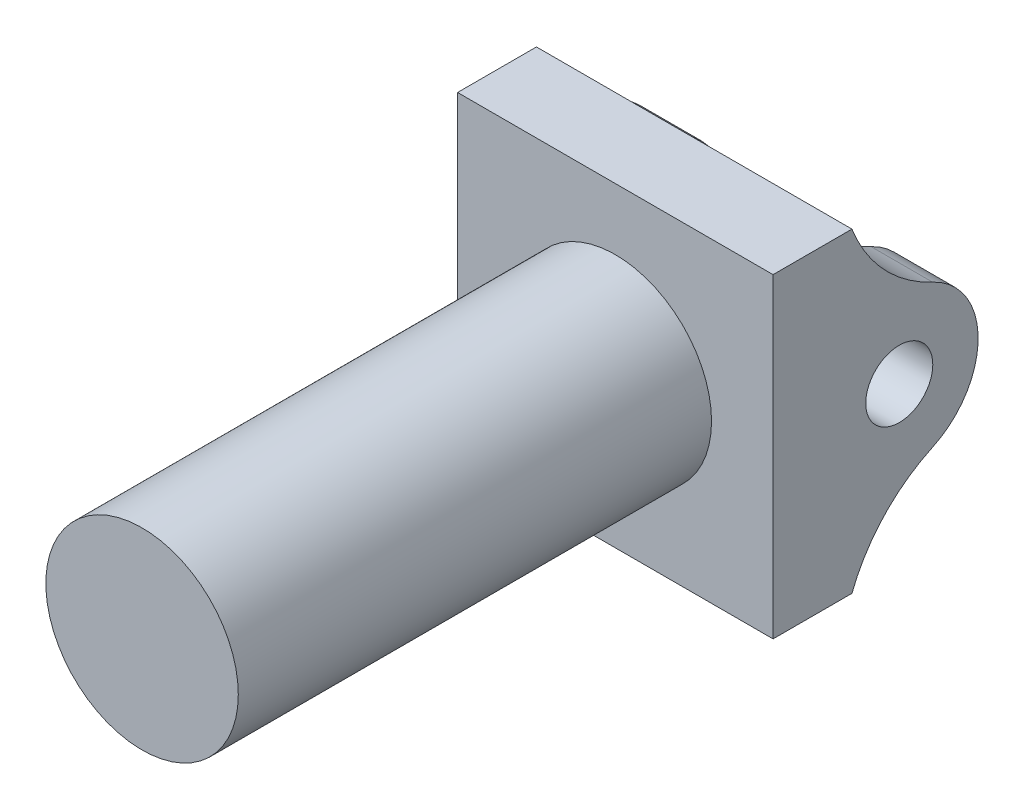
from build123d import *

# Parameters (mm, degrees)
SKETCH2_R               = 6.1
BOSS_EXTRUDE1_DEPTH     = 30
SKETCH3_W               = 20
SKETCH3_H               = 20
BOSS_EXTRUDE2_DEPTH     = 5
SKETCH4_R               = 2.125
BOSS_EXTRUDE3_DEPTH     = 20
CUT_EXTRUDE1_DEPTH      = 20
CUT_EXTRUDE1_DEPTH_BACK = 20
SKETCH5_W               = 12.2
SKETCH5_H               = 16
FILLET2_R               = 10


with BuildPart() as part:
    # Sketch2 → Boss-Extrude1 (new body)
    with BuildSketch(Plane.XY):
        Circle(SKETCH2_R)
    extrude(amount=BOSS_EXTRUDE1_DEPTH)

    # Sketch3 → Boss-Extrude2 (add)
    with BuildSketch(Plane(origin=(0, 0, 0), x_dir=(-1, 0, 0), z_dir=(0, 0, -1))):
        Rectangle(SKETCH3_W, SKETCH3_H)
    extrude(amount=BOSS_EXTRUDE2_DEPTH)

    # Sketch4 → Boss-Extrude3 (add)
    with BuildSketch(Plane(origin=(10, 0, 0), x_dir=(0, 0, -1), z_dir=(1, 0, 0))):
        with BuildLine():
            Line((5, 0), (5, 5))
            Line((5, 5), (8, 5))
            ThreePointArc((8, 5), (13, 0), (8, -5))
            Line((8, -5), (5, -5))
            Line((5, -5), (5, 0))
        make_face()
        with Locations((8, 0)):
            Circle(SKETCH4_R, mode=Mode.SUBTRACT)
    extrude(amount=-BOSS_EXTRUDE3_DEPTH)

    # Sketch5 → Cut-Extrude1 (cut, two sides: drawn at the far end of the back side and taken through both)
    with BuildSketch(Plane(origin=(0, 0, 0), x_dir=(1, 0, 0), z_dir=(0, 1, 0)).offset(-CUT_EXTRUDE1_DEPTH_BACK)):
        with Locations((0, 13)):
            Rectangle(SKETCH5_W, SKETCH5_H)
    extrude(amount=CUT_EXTRUDE1_DEPTH + CUT_EXTRUDE1_DEPTH_BACK, mode=Mode.SUBTRACT)

    # Fillet2
    # the kernel refuses this fillet: 10 mm, written as the material it adds along each edge
    with BuildSketch(Plane(origin=(6.728171707, 5, -5), x_dir=(0, -0.09101222312672333, -0.9958497754388116), z_dir=(-1, 0, 0))) as fillet2_piece_1_section:
        with BuildLine():
            CenterArc((8.508585165, -9.412424416), FILLET2_R, 109.738733942, 43.945519562)
            Line((-0.455061116, -4.979248877), (-1.351425744, -4.535931323))
            ThreePointArc((-1.351425744, -4.535931323), (-1.223380333, -2.398612215), (-0.995849775, 0.091012223))
            Line((-0.995849775, 0.091012223), (0.091012223, 0.995849775))
            ThreePointArc((0.091012223, 0.995849775), (3.078561549, 0.722813106), (4.793537035, 0.941242442))
            Line((4.793537035, 0.941242442), (5.131268683, 0))
        make_face()
    fillet2_piece_1 = extrude(amount=16.728171707, mode=Mode.PRIVATE)
    fillet2_piece_1 = split(fillet2_piece_1, bisect_by=Plane(origin=(6.1, 6.116270273, -6.110221206), z_dir=(1, 0, 0)), keep=Keep.TOP, mode=Mode.PRIVATE)
    add(fillet2_piece_1)
    with BuildSketch(Plane(origin=(-6.1, 5, -5), x_dir=(0, -0.09101222312672332, -0.9958497754388116), z_dir=(-1, 0, 0))) as fillet2_piece_2:
        with BuildLine():
            CenterArc((8.508585165, -9.412424416), FILLET2_R, 109.738733942, 43.945519562)
            Line((-0.455061116, -4.979248877), (-1.351425744, -4.535931323))
            ThreePointArc((-1.351425744, -4.535931323), (-1.223380333, -2.398612215), (-0.995849775, 0.091012223))
            Line((-0.995849775, 0.091012223), (0.091012223, 0.995849775))
            ThreePointArc((0.091012223, 0.995849775), (3.078561549, 0.722813106), (4.793537035, 0.941242442))
            Line((4.793537035, 0.941242442), (5.131268683, 0))
        make_face()
    extrude(amount=3.9)
    with BuildSketch(Plane(origin=(10, 5, -5), x_dir=(0, 1, 0), z_dir=(-1, 0, 0))) as fillet2_piece_3:
        with BuildLine():
            CenterArc((8.598975489, 9.329918297), FILLET2_R, 204.960576151, 43.945519562)
            Line((-0.46700817, 5.109972766), (-1.373606536, 4.687978213))
            ThreePointArc((-1.373606536, 4.687978213), (-1, 3), (-1, 0))
            Line((-1, 0), (0, -1))
            ThreePointArc((0, -1), (2.5, -1), (4.640102451, -0.93299183))
            Line((4.640102451, -0.93299183), (5, 0))
        make_face()
    extrude(amount=3.9)
    with BuildSketch(Plane(origin=(10, 5, -5), x_dir=(0, 1, 0), z_dir=(-1, 0, 0))) as fillet2_piece_4_section:
        with BuildLine():
            CenterArc((8.598975489, 9.329918297), FILLET2_R, 204.960576151, 43.945519562)
            Line((-0.46700817, 5.109972766), (-1.373606536, 4.687978213))
            ThreePointArc((-1.373606536, 4.687978213), (-1, 3), (-1, 0))
            Line((-1, 0), (0, -1))
            ThreePointArc((0, -1), (2.5, -1), (4.640102451, -0.93299183))
            Line((4.640102451, -0.93299183), (5, 0))
        make_face()
    fillet2_piece_4 = extrude(amount=16.728171707, mode=Mode.PRIVATE)
    fillet2_piece_4 = split(fillet2_piece_4, bisect_by=Plane(origin=(-6.1, 6.116270273, -6.110221206), z_dir=(-1, 0, 0)), keep=Keep.TOP, mode=Mode.PRIVATE)
    add(fillet2_piece_4)
    with BuildSketch(Plane(origin=(6.728171707, -5, -5), x_dir=(0, 0.0910122231267235, -0.9958497754388116), z_dir=(-1, 0, 0))) as fillet2_piece_5_section:
        with BuildLine():
            CenterArc((8.508585165, 9.412424416), FILLET2_R, 206.315746496, 43.945519562)
            Line((-0.455061116, 4.979248877), (-1.351425744, 4.535931323))
            ThreePointArc((-1.351425744, 4.535931323), (-1.223380333, 2.398612215), (-0.995849775, -0.091012223))
            Line((-0.995849775, -0.091012223), (0.091012223, -0.995849775))
            ThreePointArc((0.091012223, -0.995849775), (3.078561549, -0.722813106), (4.793537035, -0.941242442))
            Line((4.793537035, -0.941242442), (5.131268683, 0))
        make_face()
    fillet2_piece_5 = extrude(amount=16.728171707, mode=Mode.PRIVATE)
    fillet2_piece_5 = split(fillet2_piece_5, bisect_by=Plane(origin=(6.1, -6.116270273, -6.110221206), z_dir=(1, 0, 0)), keep=Keep.TOP, mode=Mode.PRIVATE)
    add(fillet2_piece_5)
    with BuildSketch(Plane(origin=(-6.1, -5, -5), x_dir=(0, 0.0910122231267235, -0.9958497754388116), z_dir=(-1, 0, 0))) as fillet2_piece_6:
        with BuildLine():
            CenterArc((8.508585165, 9.412424416), FILLET2_R, 206.315746496, 43.945519562)
            Line((-0.455061116, 4.979248877), (-1.351425744, 4.535931323))
            ThreePointArc((-1.351425744, 4.535931323), (-1.223380333, 2.398612215), (-0.995849775, -0.091012223))
            Line((-0.995849775, -0.091012223), (0.091012223, -0.995849775))
            ThreePointArc((0.091012223, -0.995849775), (3.078561549, -0.722813106), (4.793537035, -0.941242442))
            Line((4.793537035, -0.941242442), (5.131268683, 0))
        make_face()
    extrude(amount=3.9)
    with BuildSketch(Plane(origin=(10, -5, -5), x_dir=(0, -1, 0), z_dir=(-1, 0, 0))) as fillet2_piece_7:
        with BuildLine():
            CenterArc((8.598975489, -9.329918297), FILLET2_R, 111.093904287, 43.945519562)
            Line((-0.46700817, -5.109972766), (-1.373606536, -4.687978213))
            ThreePointArc((-1.373606536, -4.687978213), (-1, -3), (-1, 0))
            Line((-1, 0), (0, 1))
            ThreePointArc((0, 1), (2.5, 1), (4.640102451, 0.93299183))
            Line((4.640102451, 0.93299183), (5, 0))
        make_face()
    extrude(amount=3.9)
    with BuildSketch(Plane(origin=(10, -5, -5), x_dir=(0, -1, 0), z_dir=(-1, 0, 0))) as fillet2_piece_8_section:
        with BuildLine():
            CenterArc((8.598975489, -9.329918297), FILLET2_R, 111.093904287, 43.945519562)
            Line((-0.46700817, -5.109972766), (-1.373606536, -4.687978213))
            ThreePointArc((-1.373606536, -4.687978213), (-1, -3), (-1, 0))
            Line((-1, 0), (0, 1))
            ThreePointArc((0, 1), (2.5, 1), (4.640102451, 0.93299183))
            Line((4.640102451, 0.93299183), (5, 0))
        make_face()
    fillet2_piece_8 = extrude(amount=16.728171707, mode=Mode.PRIVATE)
    fillet2_piece_8 = split(fillet2_piece_8, bisect_by=Plane(origin=(-6.1, -6.116270273, -6.110221206), z_dir=(-1, 0, 0)), keep=Keep.TOP, mode=Mode.PRIVATE)
    add(fillet2_piece_8)


solid = part.part
